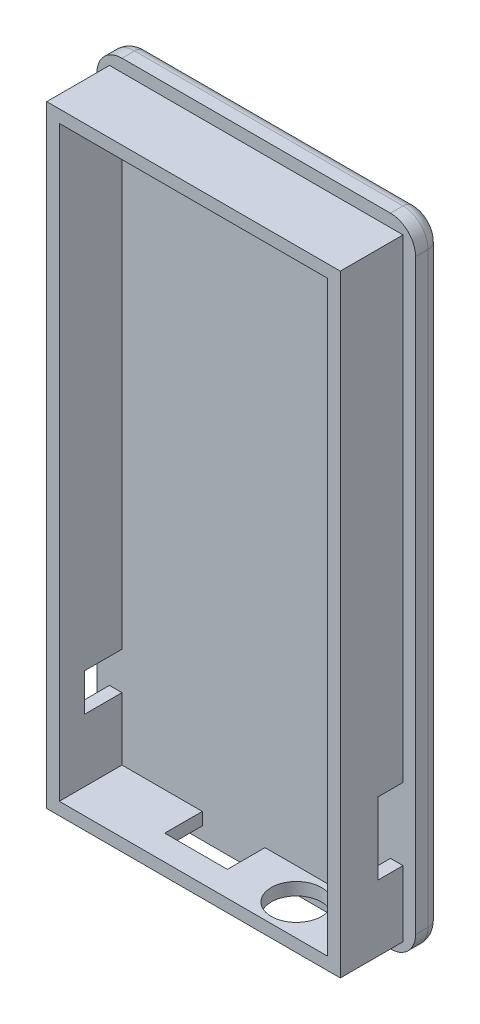
from build123d import *

# Parameters (mm, degrees)
SKETCH2_W           = 25.4
SKETCH2_H           = 50.8
BOSS_EXTRUDE1_DEPTH = 2.00000108
SKETCH3_W           = 23.39999892
SKETCH3_H           = 48.79999892
SKETCH3_W_2         = 21.39999784
SKETCH3_H_2         = 46.79999784
BOSS_EXTRUDE2_DEPTH = 4.999999906
FILLET1_R           = 2.000000064
FILLET2_R           = 1.000000032
CUT_EXTRUDE1_REACH  = 58.789
SKETCH4_W           = 2.00000108
SKETCH4_H           = 5.742378929
CUT_EXTRUDE2_REACH  = 58.34
SKETCH5_R           = 1.999996
CUT_EXTRUDE3_REACH  = 58.34
SKETCH6_W           = 4.99999
SKETCH6_H           = 2.999994
CUT_EXTRUDE4_REACH  = 58.789
SKETCH7_W           = 2.999994
SKETCH7_H           = 2.999994


with BuildPart() as part:
    # Sketch2 → Boss-Extrude1 (new body)
    with BuildSketch(Plane.XY):
        with Locations((12.7, 25.4)):
            Rectangle(SKETCH2_W, SKETCH2_H)
    extrude(amount=BOSS_EXTRUDE1_DEPTH)

    # Sketch3 → Boss-Extrude2 (add)
    with BuildSketch(Plane.XY.offset(2.00000108)):
        with Locations((12.7, 25.4)):
            Rectangle(SKETCH3_W, SKETCH3_H)
        with Locations((12.7, 25.4)):
            Rectangle(SKETCH3_W_2, SKETCH3_H_2, mode=Mode.SUBTRACT)
    extrude(amount=BOSS_EXTRUDE2_DEPTH)

    # Fillet1
    fillet1_edges = [part.edges().sort_by_distance(p)[0] for p in [
        (0, 50.8, 1.00000054),
        (0, 0, 1.00000054),
        (25.4, 0, 1.00000054),
        (25.4, 50.8, 1.00000054),
    ]]
    fillet(fillet1_edges, radius=FILLET1_R)

    # Fillet2
    fillet2_edges = [part.edges().sort_by_distance(p)[0] for p in [
        (0.585786456, 0.585786456, 0),
        (12.7, 0, 0),
        (24.814213544, 0.585786456, 0),
        (25.4, 25.4, 0),
        (24.814213544, 50.214213544, 0),
        (12.7, 50.8, 0),
        (0.585786456, 50.214213544, 0),
        (0, 25.4, 0),
    ]]
    fillet(fillet2_edges, radius=FILLET2_R)

    # Sketch4 → Cut-Extrude1 (cut, up to next)
    with BuildSketch(Plane(origin=(24.39999946, 0, 0), x_dir=(0, 0, -1), z_dir=(1, 0, 0)), mode=Mode.PRIVATE) as cut_extrude1_sk1:
        with Locations((-3.00000162, 9.1287906)):
            Rectangle(SKETCH4_W, SKETCH4_H)
    cut_extrude1_tool1 = extrude(cut_extrude1_sk1.sketch, amount=-CUT_EXTRUDE1_REACH, mode=Mode.PRIVATE) & part.part
    add(cut_extrude1_tool1.solids().sort_by_distance((24.399999, 9.128791, 3.000002))[0], mode=Mode.SUBTRACT)

    # Sketch5 → Cut-Extrude2 (cut, up to next)
    with BuildSketch(Plane.XZ.offset(-1.00000054), mode=Mode.PRIVATE) as cut_extrude2_sk1:
        with Locations((18.400009936, 4.50000116)):
            Circle(SKETCH5_R)
    cut_extrude2_tool1 = extrude(cut_extrude2_sk1.sketch, amount=-CUT_EXTRUDE2_REACH, mode=Mode.PRIVATE) & part.part
    add(cut_extrude2_tool1.solids().sort_by_distance((18.40001, 1.000001, 4.500001))[0], mode=Mode.SUBTRACT)

    # Sketch6 → Cut-Extrude3 (cut, up to next)
    with BuildSketch(Plane.XZ.offset(-1.00000054), mode=Mode.PRIVATE) as cut_extrude3_sk1:
        with Locations((10.899999536, 3.49999808)):
            Rectangle(SKETCH6_W, SKETCH6_H)
    cut_extrude3_tool1 = extrude(cut_extrude3_sk1.sketch, amount=-CUT_EXTRUDE3_REACH, mode=Mode.PRIVATE) & part.part
    add(cut_extrude3_tool1.solids().sort_by_distance((10.9, 1.000001, 3.499998))[0], mode=Mode.SUBTRACT)

    # Sketch7 → Cut-Extrude4 (cut, up to next)
    with BuildSketch(Plane.ZY.offset(-1.00000054), mode=Mode.PRIVATE) as cut_extrude4_sk1:
        with Locations((3.49999808, 8.499987064)):
            Rectangle(SKETCH7_W, SKETCH7_H)
    cut_extrude4_tool1 = extrude(cut_extrude4_sk1.sketch, amount=-CUT_EXTRUDE4_REACH, mode=Mode.PRIVATE) & part.part
    add(cut_extrude4_tool1.solids().sort_by_distance((1.000001, 8.499987, 3.499998))[0], mode=Mode.SUBTRACT)


solid = part.part
